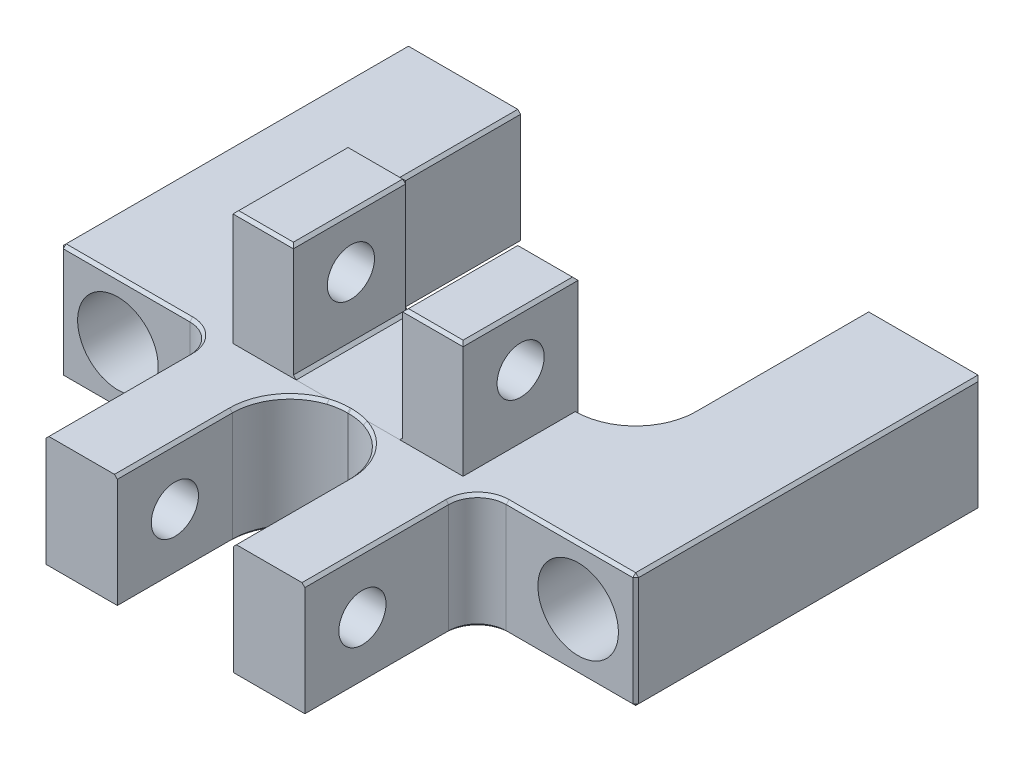
from build123d import *

# Parameters (mm, degrees)
SKETCH1_W           = 100
SKETCH1_H           = 20
SKETCH1_R           = 3.15
BOSS_EXTRUDE1_DEPTH = 20
SKETCH8_W           = 40
SKETCH8_H           = 20
BOSS_EXTRUDE2_DEPTH = 20
SKETCH9_W           = 19
SKETCH9_H           = 40
CUT_EXTRUDE5_DEPTH  = 20
SKETCH10_R          = 4.1
CUT_EXTRUDE6_DEPTH  = 79.74007874
SKETCH11_W          = 12.4
SKETCH11_H          = 20
BOSS_EXTRUDE3_DEPTH = 30
FILLET1_R           = 10
FILLET2_R           = 5
SKETCH12_R          = 4.1
CUT_EXTRUDE7_DEPTH  = 94.03897033
BOSS_EXTRUDE4_START = 40
SKETCH13_W          = 20
SKETCH13_H          = 20
SKETCH13_R          = 3.15
BOSS_EXTRUDE4_DEPTH = 40
FILLET3_R           = 10
CHAMFER1_SIZE       = 0.5
SKETCH5_R           = 7
CUT_EXTRUDE3_DEPTH  = 50


with BuildPart() as part:
    # Sketch1 → Boss-Extrude1 (new body)
    with BuildSketch(Plane.XY):
        Rectangle(SKETCH1_W, SKETCH1_H)
        with Locations((-40, 0)):
            Circle(SKETCH1_R, mode=Mode.SUBTRACT)
        with Locations((40, 0)):
            Circle(SKETCH1_R, mode=Mode.SUBTRACT)
    extrude(amount=BOSS_EXTRUDE1_DEPTH)

    # Sketch8 → Boss-Extrude2 (add)
    with BuildSketch(Plane(origin=(0, 10, 0), x_dir=(1, 0, 0), z_dir=(0, 1, 0))):
        with Locations((0, -10)):
            Rectangle(SKETCH8_W, SKETCH8_H)
    extrude(amount=BOSS_EXTRUDE2_DEPTH)

    # Sketch9 → Cut-Extrude5 (cut)
    with BuildSketch(Plane(origin=(0, 30, 0), x_dir=(1, 0, 0), z_dir=(0, 1, 0))):
        Rectangle(SKETCH9_W, SKETCH9_H)
    extrude(amount=-CUT_EXTRUDE5_DEPTH, mode=Mode.SUBTRACT)

    # Sketch10 → Cut-Extrude6 (cut, through all)
    with BuildSketch(Plane(origin=(20, 0, 0), x_dir=(0, 0, -1), z_dir=(1, 0, 0))):
        with Locations((-10, 21)):
            Circle(SKETCH10_R)
    extrude(amount=-CUT_EXTRUDE6_DEPTH, mode=Mode.SUBTRACT)

    # Sketch11 → Boss-Extrude3 (add)
    with BuildSketch(Plane.XY.offset(20)):
        with Locations((-16.3, 0)):
            Rectangle(SKETCH11_W, SKETCH11_H)
        with Locations((16.3, 0)):
            Rectangle(SKETCH11_W, SKETCH11_H)
    extrude(amount=BOSS_EXTRUDE3_DEPTH)

    # Fillet1
    # the kernel refuses this fillet: 10 mm, written as the material it adds along each edge
    with BuildSketch(Plane(origin=(-10.1, 10, 20), x_dir=(1, 0, 0), z_dir=(0, -1, 0))) as fillet1_piece_1:
        with BuildLine():
            CenterArc((FILLET1_R, FILLET1_R), FILLET1_R, 180, 90)
            Line((0, FILLET1_R), (0, 0))
            Line((0, 0), (FILLET1_R, 0))
        make_face()
    extrude(amount=20)
    with BuildSketch(Plane(origin=(10.1, 10, 20), x_dir=(-1, 0, 0), z_dir=(0, -1, 0))) as fillet1_piece_2:
        with BuildLine():
            CenterArc((FILLET1_R, -FILLET1_R), FILLET1_R, 90, 90)
            Line((0, -FILLET1_R), (0, 0))
            Line((0, 0), (FILLET1_R, 0))
        make_face()
    extrude(amount=20)

    # Fillet2
    fillet2_edges = [part.edges().sort_by_distance(p)[0] for p in [
        (-22.5, 0, 20),
        (22.5, 0, 20),
    ]]
    fillet(fillet2_edges, radius=FILLET2_R)

    # Sketch12 → Cut-Extrude7 (cut, through all)
    with BuildSketch(Plane(origin=(22.5, 0, 0), x_dir=(0, 0, -1), z_dir=(1, 0, 0))):
        with Locations((-40, 0)):
            Circle(SKETCH12_R)
    extrude(amount=-CUT_EXTRUDE7_DEPTH, mode=Mode.SUBTRACT)

    # Sketch13 → Boss-Extrude4 (add)
    # profile 1 of 2: a face of its own
    with BuildSketch(Plane(origin=(0, 0, 0), x_dir=(-1, 0, 0), z_dir=(0, 0, -1)).offset(BOSS_EXTRUDE4_START)):
        with Locations((-40, 0)):
            Rectangle(SKETCH13_W, SKETCH13_H)
        with Locations((-40, 0)):
            Circle(SKETCH13_R, mode=Mode.SUBTRACT)
    # profile 2 of 2: a face of its own
    with BuildSketch(Plane(origin=(0, 0, 0), x_dir=(-1, 0, 0), z_dir=(0, 0, -1)).offset(BOSS_EXTRUDE4_START)):
        with Locations((40, 0)):
            Rectangle(SKETCH13_W, SKETCH13_H)
        with Locations((40, 0)):
            Circle(SKETCH13_R, mode=Mode.SUBTRACT)
    extrude(amount=-BOSS_EXTRUDE4_DEPTH)

    # Fillet3
    fillet3_edges = [part.edges().sort_by_distance(p)[0] for p in [
        (-30, 0, 0),
        (30, 0, 0),
    ]]
    fillet(fillet3_edges, radius=FILLET3_R)

    # Chamfer1
    chamfer1_edges = [part.edges().sort_by_distance(p)[0] for p in [
        (-7.171067812, -10, 22.928932188),
        (-50, 0, 20),
        (-38.75, 10, 20),
        (38.75, -10, 20),
        (-23.964466094, -10, 21.464466094),
        (-23.964466094, 10, 21.464466094),
        (23.964466094, 10, 21.464466094),
        (23.964466094, -10, 21.464466094),
        (50, 0, -40),
        (40, -10, -40),
        (30, -10, -25),
        (30, 10, -25),
        (-50, 0, -40),
        (-40, -10, -40),
        (-38.75, -10, 20),
        (-30, 10, -25),
        (-30, -10, -25),
        (0, -10, 0),
        (-27.071067812, -10, -2.928932188),
        (-27.071067812, 10, -2.928932188),
        (27.071067812, 10, -2.928932188),
        (27.071067812, -10, -2.928932188),
        (-20, 30, 10),
        (-14.75, 30, 20),
        (20, 30, 10),
        (14.75, 30, 0),
        (14.75, 30, 20),
        (-14.75, 30, 0),
        (-9.5, 30, 10),
        (0, 10, 0),
        (9.5, 20, 0),
        (-9.5, 20, 0),
        (9.5, 10, 10),
        (-9.5, 10, 10),
        (9.5, 30, 10),
        (50, 0, 20),
        (-22.5, 10, 37.5),
        (-22.5, -10, 37.5),
        (-10.1, -10, 40),
        (-10.1, 10, 40),
        (-16.3, -10, 50),
        (50, -10, -10),
        (-50, -10, -10),
        (22.5, -10, 37.5),
        (-50, 10, -10),
        (22.5, 10, 37.5),
        (10.1, 10, 40),
        (50, 10, -10),
        (10.1, -10, 40),
        (16.3, -10, 50),
        (38.75, 10, 20),
        (0, 10, 20),
        (0, -10, 20),
        (7.171067812, -10, 22.928932188),
        (7.171067812, 10, 22.928932188),
        (-7.171067812, 10, 22.928932188),
    ]]
    chamfer(chamfer1_edges, length=CHAMFER1_SIZE)

    # Sketch5 → Cut-Extrude3 (cut)
    with BuildSketch(Plane.XY.offset(20)):
        with Locations((-40, 0)):
            Circle(SKETCH5_R)
        with Locations((40, 0)):
            Circle(SKETCH5_R)
    extrude(amount=-CUT_EXTRUDE3_DEPTH, mode=Mode.SUBTRACT)


solid = part.part
